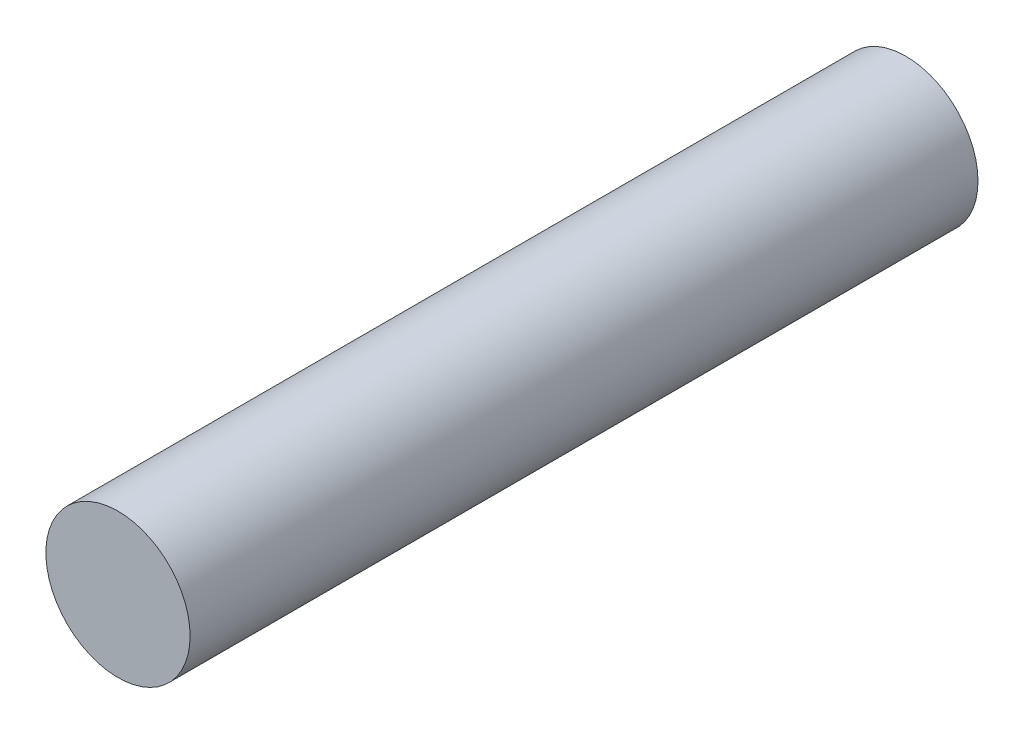
from build123d import *

# Parameters (mm, degrees)
SKETCH3_R           = 78.35
BOSS_EXTRUDE1_DEPTH = 855.897969027


with BuildPart() as part:
    # Sketch3 → Boss-Extrude1 (new body)
    with BuildSketch(Plane.XY):
        Circle(SKETCH3_R)
    extrude(amount=-BOSS_EXTRUDE1_DEPTH)


solid = part.part
